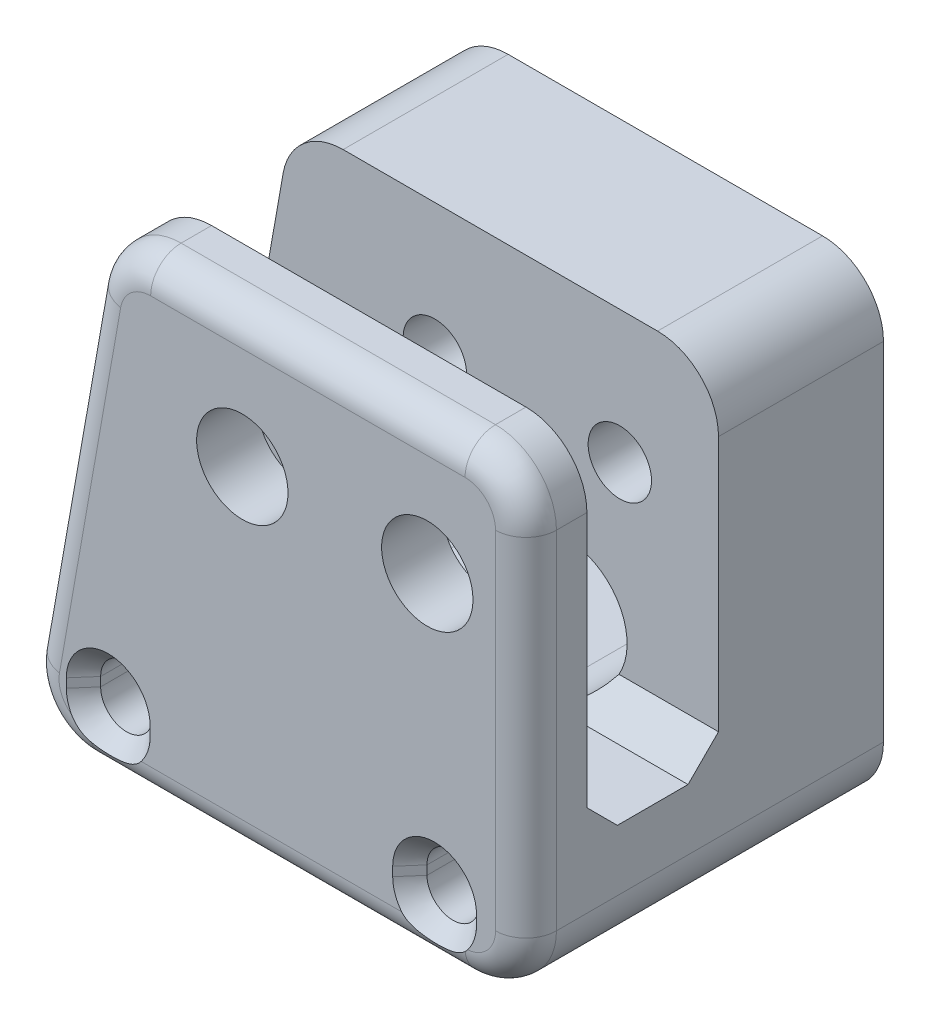
from build123d import *

# Parameters (mm, degrees)
BOSS_EXTRUDE1_DEPTH                           = 3.175
BOSS_EXTRUDE2_START                           = -6.8580000000000005
BOSS_EXTRUDE2_DEPTH                           = 8.5979
BOSS_EXTRUDE3_DEPTH                           = 6.858
CSK_START                                     = -16
CSK_SLOT_FOR_2_FLAT_HEAD_MACHINE_SCREW1_DEPTH = 19.175
FILLET1_R                                     = 3.175
CHAMFER1_SIZE                                 = 1.5875
F_3_16_0_1875_DIAMETER_HOLE1_D                = 4.7625
F_3_16_0_1875_DIAMETER_HOLE1_DEPTH            = 3.175
F_0_CLEARANCE_HOLE1_D                         = 1.8542
HOLE1_AT_2_COUNT                              = 2
HOLE1_AT_2_PITCH                              = 9.639299999999615
CUT_EXTRUDE2_REACH                            = 30.823
FILLET3_R                                     = 1.5875


with BuildPart() as part:
    # Sketch1 → Boss-Extrude1 (new body)
    with BuildSketch(Plane.XY):
        Polygon((9.994900000000026, 9.271000000002116), (9.99490000000003, -15.162995594937385), (-16.538472669899683, -15.162995594937387), (-12.230099999999974, 9.271000000002113), align=None)
    extrude(amount=BOSS_EXTRUDE1_DEPTH)



with BuildPart() as body_2:
    # Sketch1<2> → Boss-Extrude2 (new body)
    with BuildSketch(Plane.XY.offset(BOSS_EXTRUDE2_START)):
        Polygon((9.994900000000026, 9.271000000002116), (9.99490000000003, -15.162995594937385), (-16.538472669899683, -15.162995594937387), (-12.230099999999974, 9.271000000002113), align=None)
    extrude(amount=-BOSS_EXTRUDE2_DEPTH)


with BuildPart() as part_1:
    add(part.part)

    add(body_2.part)  # Boss-Extrude3 merges body 2
    # Sketch3 → Boss-Extrude3 (add)
    with BuildSketch(Plane.XY.offset(-6.8580000000000005)):
        Polygon((9.994900000000026, -8.812995594937385), (9.99490000000003, -15.162995594937385), (-16.538472669899683, -15.162995594937387), (-15.418796342400908, -8.812995594937385), align=None)
    extrude(amount=BOSS_EXTRUDE3_DEPTH)

    # CSK SLOT for #2 Flat Head Machine Screw1: read off the stored shape, not the designer's step
    # CSK SLOT for _2 Flat Head Machine Sc 2 → CSK SLOT for #2 Flat Head Machine Screw1 (cut)
    with BuildSketch(Plane.XY.offset(CSK_START)):
        with BuildLine():
            Line((-10.42342267, -12.222945595), (-10.42342267, -11.753045595))
            ThreePointArc((-10.42342267, -11.753045595), (-11.77597267, -10.400495595), (-13.12852267, -11.753045595))
            Line((-13.12852267, -11.753045595), (-13.12852267, -12.222945595))
            ThreePointArc((-13.12852267, -12.222945595), (-11.77597267, -13.575495595), (-10.42342267, -12.222945595))
        make_face()
        with BuildLine():
            Line((6.58495, -12.222945595), (6.58495, -11.753045595))
            ThreePointArc((6.58495, -11.753045595), (5.2324, -10.400495595), (3.87985, -11.753045595))
            Line((3.87985, -11.753045595), (3.87985, -12.222945595))
            ThreePointArc((3.87985, -12.222945595), (5.2324, -13.575495595), (6.58495, -12.222945595))
        make_face()
    extrude(amount=CSK_SLOT_FOR_2_FLAT_HEAD_MACHINE_SCREW1_DEPTH, mode=Mode.SUBTRACT)

    # CSK SLOT for _2 Flat Head Machine Sc 3: loft between two sections, ruled curve by curve
    csk_slot_for_2_flat_head_machine_sc_3_from = [
        Edge.make_three_point_arc((-10.42342267, -11.753045595, 2.21806604), (-10.819575393, -10.796648318, 2.21806604), (-11.77597267, -10.400495595, 2.21806604)),
        Edge.make_three_point_arc((-11.77597267, -10.400495595, 2.21806604), (-12.732369947, -10.796648318, 2.21806604), (-13.12852267, -11.753045595, 2.21806604)),
        Edge.make_three_point_arc((-13.12852267, -12.222945595, 2.21806604), (-12.732369947, -13.179342872, 2.21806604), (-11.77597267, -13.575495595, 2.21806604)),
        Edge.make_three_point_arc((-11.77597267, -13.575495595, 2.21806604), (-10.819575393, -13.179342872, 2.21806604), (-10.42342267, -12.222945595, 2.21806604)),
        Edge.make_line((-13.12852267, -11.753045595, 2.21806604), (-13.12852267, -12.222945595, 2.21806604)),
        Edge.make_line((-10.42342267, -11.753045595, 2.21806604), (-10.42342267, -12.222945595, 2.21806604)),
    ]
    csk_slot_for_2_flat_head_machine_sc_3_to = [
        Edge.make_three_point_arc((-9.59157267, -11.753045595, 3.175), (-10.231368617, -10.208441542, 3.175), (-11.77597267, -9.568645595, 3.175)),
        Edge.make_three_point_arc((-11.77597267, -9.568645595, 3.175), (-13.320576723, -10.208441542, 3.175), (-13.96037267, -11.753045595, 3.175)),
        Edge.make_three_point_arc((-13.96037267, -12.222945595, 3.175), (-13.320576723, -13.767549648, 3.175), (-11.77597267, -14.407345595, 3.175)),
        Edge.make_three_point_arc((-11.77597267, -14.407345595, 3.175), (-10.231368617, -13.767549648, 3.175), (-9.59157267, -12.222945595, 3.175)),
        Edge.make_line((-13.96037267, -11.753045595, 3.175), (-13.96037267, -12.222945595, 3.175)),
        Edge.make_line((-9.59157267, -11.753045595, 3.175), (-9.59157267, -12.222945595, 3.175)),
    ]
    csk_slot_for_2_flat_head_machine_sc_3 = Solid(Shell([*[Face.make_surface_from_curves(csk_slot_for_2_flat_head_machine_sc_3_from[k], csk_slot_for_2_flat_head_machine_sc_3_to[k]) for k in range(6)], Face(Wire(csk_slot_for_2_flat_head_machine_sc_3_from)), Face(Wire(csk_slot_for_2_flat_head_machine_sc_3_to))]))
    add(csk_slot_for_2_flat_head_machine_sc_3, mode=Mode.SUBTRACT)

    # CSK SLOT for _2 Flat Head Machine Sc 4: loft between two sections, ruled curve by curve
    csk_slot_for_2_flat_head_machine_sc_4_from = [
        Edge.make_three_point_arc((6.58495, -11.753045595, 2.21806604), (6.188797277, -10.796648318, 2.21806604), (5.2324, -10.400495595, 2.21806604)),
        Edge.make_three_point_arc((5.2324, -10.400495595, 2.21806604), (4.276002723, -10.796648318, 2.21806604), (3.87985, -11.753045595, 2.21806604)),
        Edge.make_three_point_arc((3.87985, -12.222945595, 2.21806604), (4.276002723, -13.179342872, 2.21806604), (5.2324, -13.575495595, 2.21806604)),
        Edge.make_three_point_arc((5.2324, -13.575495595, 2.21806604), (6.188797277, -13.179342872, 2.21806604), (6.58495, -12.222945595, 2.21806604)),
        Edge.make_line((3.87985, -11.753045595, 2.21806604), (3.87985, -12.222945595, 2.21806604)),
        Edge.make_line((6.58495, -11.753045595, 2.21806604), (6.58495, -12.222945595, 2.21806604)),
    ]
    csk_slot_for_2_flat_head_machine_sc_4_to = [
        Edge.make_three_point_arc((7.4168, -11.753045595, 3.175), (6.777004053, -10.208441542, 3.175), (5.2324, -9.568645595, 3.175)),
        Edge.make_three_point_arc((5.2324, -9.568645595, 3.175), (3.687795947, -10.208441542, 3.175), (3.048, -11.753045595, 3.175)),
        Edge.make_three_point_arc((3.048, -12.222945595, 3.175), (3.687795947, -13.767549648, 3.175), (5.2324, -14.407345595, 3.175)),
        Edge.make_three_point_arc((5.2324, -14.407345595, 3.175), (6.777004053, -13.767549648, 3.175), (7.4168, -12.222945595, 3.175)),
        Edge.make_line((3.048, -11.753045595, 3.175), (3.048, -12.222945595, 3.175)),
        Edge.make_line((7.4168, -11.753045595, 3.175), (7.4168, -12.222945595, 3.175)),
    ]
    csk_slot_for_2_flat_head_machine_sc_4 = Solid(Shell([*[Face.make_surface_from_curves(csk_slot_for_2_flat_head_machine_sc_4_from[k], csk_slot_for_2_flat_head_machine_sc_4_to[k]) for k in range(6)], Face(Wire(csk_slot_for_2_flat_head_machine_sc_4_from)), Face(Wire(csk_slot_for_2_flat_head_machine_sc_4_to))]))
    add(csk_slot_for_2_flat_head_machine_sc_4, mode=Mode.SUBTRACT)

    # Fillet1
    fillet1_edges = [part_1.edges().sort_by_distance(p)[0] for p in [
        (-12.230099999999974, 9.271000000002113, -11.15695),
        (9.994900000000026, 9.271000000002116, -11.15695),
        (9.994900000000026, 9.271000000002116, 1.5875),
        (9.99490000000003, -15.162995594937385, -6.14045),
        (-16.538472669899683, -15.162995594937387, -6.14045),
        (-12.230099999999974, 9.271000000002113, 1.5875),
    ]]
    fillet(fillet1_edges, radius=FILLET1_R)

    # Chamfer1
    chamfer1_edges = [part_1.edges().sort_by_distance(p)[0] for p in [
        (-2.711948171200442, -8.812995594937385, -6.8580000000000005),
        (-2.711948171200442, -8.812995594937385, -8.9e-16),
    ]]
    chamfer(chamfer1_edges, length=CHAMFER1_SIZE)

    # 3/16 (0.1875) Diameter Hole1
    with Locations(Plane.XY.offset(3.175)):
        with Locations((4.8514, 2.3622), (-4.7879, 2.3622)):
            Hole(F_3_16_0_1875_DIAMETER_HOLE1_D / 2, depth=F_3_16_0_1875_DIAMETER_HOLE1_DEPTH)

    # #0 Clearance Hole1 (through all)
    with Locations(Plane(origin=(8.5e-16, -4.198e-14, -15.455900000000726), x_dir=(-1, 0, -6e-17), z_dir=(6e-17, -2.72e-15, -1))):
        with Locations((-4.8514, 2.3622), (4.7879, 2.3622)):
            Hole(F_0_CLEARANCE_HOLE1_D / 2)

    # Sketch11 → Hole1 (revolve, cut)
    with BuildSketch(Plane(origin=(4.851400000000893, 2.362200000000807, -6.8580000000000005), x_dir=(0, -1, 0), z_dir=(1, 0, 0))):
        Polygon((0, 0), (0, 3.047999999999995), (1.524000000000013, 3.047999999999995), (1.6510000000000136, 0), align=None)
    hole1 = revolve(axis=Axis((4.851400000000893, 2.362200000000807, -116.858), (0, 0, 1)), mode=Mode.SUBTRACT)

    # Hole1 at 2: Hole1 ×2
    with Locations(*[(-i * HOLE1_AT_2_PITCH, 0, 0) for i in range(1, HOLE1_AT_2_COUNT)]):
        add(hole1, mode=Mode.SUBTRACT)

    # Sketch13 → Cut-Extrude2 (cut, up to next)
    with BuildSketch(Plane(origin=(8.5e-16, -4.198e-14, -15.455900000000726), x_dir=(-1, 0, -6e-17), z_dir=(6e-17, -2.72e-15, -1)), mode=Mode.PRIVATE) as cut_extrude2_sk1:
        with BuildLine():
            Line((-2.0574000000000243, -2.4629955949373814), (6.847988939545661, -2.4629955949373823))
            ThreePointArc((6.847988939545661, -2.4629955949373823), (10.022988939545662, -5.637995594937381), (6.847988939545661, -8.812995594937382))
            Line((6.847988939545661, -8.812995594937382), (-2.0574000000000243, -8.812995594937382))
            ThreePointArc((-2.0574000000000243, -8.812995594937382), (-5.232400000000023, -5.63799559493738), (-2.0574000000000243, -2.4629955949373814))
        make_face()
    cut_extrude2_tool1 = extrude(cut_extrude2_sk1.sketch, amount=-CUT_EXTRUDE2_REACH, mode=Mode.PRIVATE) & part_1.part
    add(cut_extrude2_tool1.solids().sort_by_distance((-2.395294, -5.637996, -15.4559))[0], mode=Mode.SUBTRACT)

    # Fillet3
    # the kernel refuses this fillet: 1.5875 mm, written as the material it takes off along each edge
    with BuildSketch(Plane(origin=(-15.88141962922681, -11.436662630844875, 3.175), x_dir=(0.9848077530122074, -0.173648177666934, 0), z_dir=(0.17364817766693402, 0.9848077530122075, 0))) as fillet3_piece_1:
        with BuildLine():
            CenterArc((FILLET3_R, FILLET3_R), FILLET3_R, 180, 90)
            Line((-2.06e-15, FILLET3_R), (0, 0))
            Line((0, 0), (FILLET3_R, 0))
        make_face()
    extrude(amount=18.362970376326174, mode=Mode.SUBTRACT)
    with BuildSketch(Plane(origin=(-9.565958671012117, 9.271000000002113, 3.175), x_dir=(1.6e-16, -1, 0), z_dir=(1, 1.6e-16, 0))) as fillet3_piece_2:
        with BuildLine():
            CenterArc((FILLET3_R, FILLET3_R), FILLET3_R, 180, 90)
            Line((0, FILLET3_R), (0, 0))
            Line((0, 0), (FILLET3_R, 0))
        make_face()
    extrude(amount=16.385858671012144, mode=Mode.SUBTRACT)
    with BuildSketch(Plane(origin=(6.819900000000029, -15.162995594937385, 3.175), x_dir=(-7e-17, 1, 0), z_dir=(-1, -7e-17, 0))) as fillet3_piece_3:
        with BuildLine():
            CenterArc((FILLET3_R, FILLET3_R), FILLET3_R, 180, 90)
            Line((0, FILLET3_R), (0, 0))
            Line((0, 0), (FILLET3_R, 0))
        make_face()
    extrude(amount=19.574555013413082, mode=Mode.SUBTRACT)
    with BuildSketch(Plane(origin=(9.994900000000026, 6.096000000002116, 3.175), x_dir=(0, 0, -1), z_dir=(1.5e-16, -1, 0))) as fillet3_piece_4:
        with BuildLine():
            CenterArc((FILLET3_R, -FILLET3_R), FILLET3_R, 90, 90)
            Line((0, -FILLET3_R), (0, 0))
            Line((0, 0), (FILLET3_R, 0))
        make_face()
    extrude(amount=18.0839955949395, mode=Mode.SUBTRACT)
    with BuildSketch(Plane(origin=(-12.754655013413053, -11.987995594937388, 3.175), x_dir=(0, -1, 0), z_dir=(1, 0, 0))) as fillet3_piece_5:
        with BuildLine():
            CenterArc((3.1750000000000007 - FILLET3_R, FILLET3_R), FILLET3_R, 270, 89.99999999999999)
            Line((3.1750000000000007, FILLET3_R), (3.1750000000000007, 0))
            Line((3.1750000000000007, 0), (3.1750000000000007 - FILLET3_R, 0))
        make_face()
    revolve(axis=Axis((-12.754655013413053, -11.987995594937388, 3.175), (0, 0, -1)), revolution_arc=100.00000000000018, mode=Mode.SUBTRACT)
    with BuildSketch(Plane(origin=(6.819900000000029, -11.987995594937384, 3.175), x_dir=(1, 0, 0), z_dir=(0, 1, 0))) as fillet3_piece_6:
        with BuildLine():
            CenterArc((3.1750000000000007 - FILLET3_R, FILLET3_R), FILLET3_R, 270, 89.99999999999999)
            Line((3.1750000000000007, FILLET3_R), (3.1750000000000007, 0))
            Line((3.1750000000000007, 0), (3.1750000000000007 - FILLET3_R, 0))
        make_face()
    revolve(axis=Axis((6.819900000000029, -11.987995594937384, 3.175), (0, 0, -1)), revolution_arc=90, mode=Mode.SUBTRACT)
    with BuildSketch(Plane(origin=(6.819900000000027, 6.096000000002116, 3.175), x_dir=(1, 5.6e-16, 0), z_dir=(5.6e-16, -1, 0))) as fillet3_piece_7:
        with BuildLine():
            CenterArc((3.174999999999999 - FILLET3_R, -FILLET3_R), FILLET3_R, 0, 90)
            Line((3.174999999999999 - FILLET3_R, 0), (3.174999999999999, 0))
            Line((3.174999999999999, 0), (3.174999999999999, -FILLET3_R))
        make_face()
    revolve(axis=Axis((6.819900000000027, 6.096000000002116, 3.175), (0, 0, 1)), revolution_arc=89.99999999999996, mode=Mode.SUBTRACT)
    with BuildSketch(Plane(origin=(-9.565958671012119, 6.096000000002116, 3.175), x_dir=(0, 1, 0), z_dir=(1, 0, 0))) as fillet3_piece_8:
        with BuildLine():
            CenterArc((3.174999999999999 - FILLET3_R, -FILLET3_R), FILLET3_R, 1.603e-14, 90)
            Line((3.174999999999999, -FILLET3_R), (3.174999999999999, 0))
            Line((3.174999999999999, 0), (3.174999999999999 - FILLET3_R, 0))
        make_face()
    revolve(axis=Axis((-9.565958671012119, 6.096000000002116, 3.175), (0, 0, 1)), revolution_arc=79.99999999999976, mode=Mode.SUBTRACT)


solid = part_1.part
